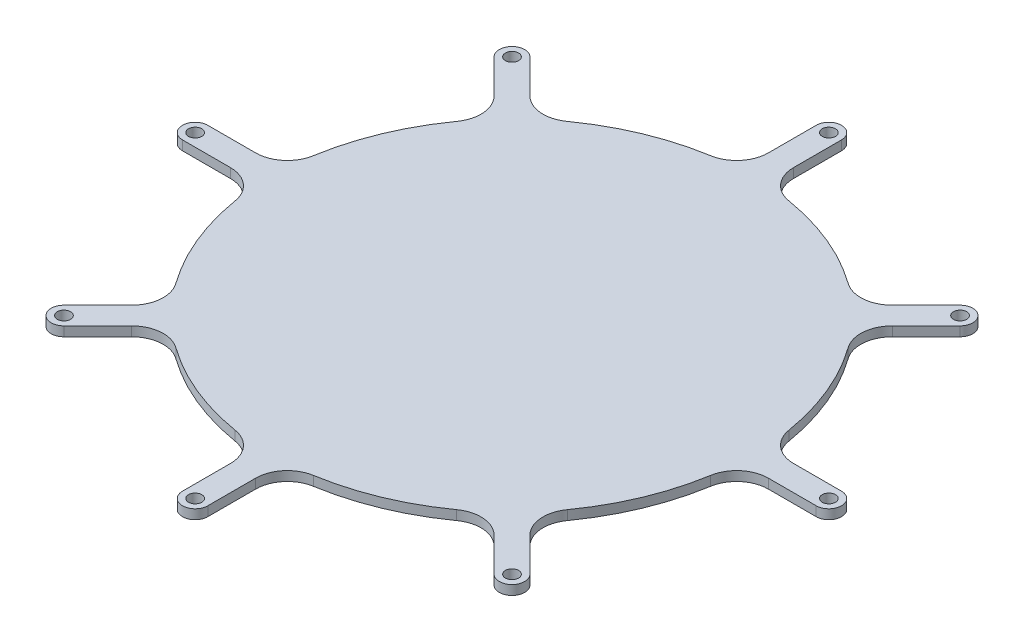
from build123d import *

# Parameters (mm, degrees)
BOSS_EXTRUDE1_DEPTH = 3
SKETCH3_R           = 2.1
CUT_EXTRUDE1_DEPTH  = 5
FILLET1_R           = 10


with BuildPart() as part:
    # Sketch1 → Boss-Extrude1 (new body)
    with BuildSketch(Plane(origin=(0, 0, 0), x_dir=(1, 0, 0), z_dir=(0, 1, 0))):
        with BuildLine():
            ThreePointArc((56.614433204, -50.957578955), (70.371903991, -29.148997043), (76.064899264, -4))
            Line((76.064899264, -4), (100.17, -4))
            ThreePointArc((100.17, -4), (104.17, 0), (100.17, 4))
            Line((100.17, 4), (76.064899264, 4))
            ThreePointArc((76.064899264, 4), (70.371903991, 29.148997043), (56.614433204, 50.957578955))
            Line((56.614433204, 50.957578955), (73.659313396, 68.002459147))
            ThreePointArc((73.659313396, 68.002459147), (73.659313396, 73.659313396), (68.002459147, 73.659313396))
            Line((68.002459147, 73.659313396), (50.957578955, 56.614433204))
            ThreePointArc((50.957578955, 56.614433204), (29.148997043, 70.371903991), (4, 76.064899264))
            Line((4, 76.064899264), (4, 100.17))
            ThreePointArc((4, 100.17), (0, 104.17), (-4, 100.17))
            Line((-4, 100.17), (-4, 76.064899264))
            ThreePointArc((-4, 76.064899264), (-29.148997043, 70.371903991), (-50.957578955, 56.614433204))
            Line((-50.957578955, 56.614433204), (-68.002459147, 73.659313396))
            ThreePointArc((-68.002459147, 73.659313396), (-73.659313396, 73.659313396), (-73.659313396, 68.002459147))
            Line((-73.659313396, 68.002459147), (-56.614433204, 50.957578955))
            ThreePointArc((-56.614433204, 50.957578955), (-70.371903991, 29.148997043), (-76.064899264, 4))
            Line((-76.064899264, 4), (-100.17, 4))
            ThreePointArc((-100.17, 4), (-104.17, 0), (-100.17, -4))
            Line((-100.17, -4), (-76.064899264, -4))
            ThreePointArc((-76.064899264, -4), (-70.371903991, -29.148997043), (-56.614433204, -50.957578955))
            Line((-56.614433204, -50.957578955), (-73.659313396, -68.002459147))
            ThreePointArc((-73.659313396, -68.002459147), (-73.659313396, -73.659313396), (-68.002459147, -73.659313396))
            Line((-68.002459147, -73.659313396), (-50.957578955, -56.614433204))
            ThreePointArc((-50.957578955, -56.614433204), (-29.148997043, -70.371903991), (-4, -76.064899264))
            Line((-4, -76.064899264), (-4, -100.17))
            ThreePointArc((-4, -100.17), (0, -104.17), (4, -100.17))
            Line((4, -100.17), (4, -76.064899264))
            ThreePointArc((4, -76.064899264), (29.148997043, -70.371903991), (50.957578955, -56.614433204))
            Line((50.957578955, -56.614433204), (68.002459147, -73.659313396))
            ThreePointArc((68.002459147, -73.659313396), (73.659313396, -73.659313396), (73.659313396, -68.002459147))
            Line((73.659313396, -68.002459147), (56.614433204, -50.957578955))
        make_face()
    extrude(amount=BOSS_EXTRUDE1_DEPTH)

    # Sketch3 → Cut-Extrude1 (cut)
    with BuildSketch(Plane(origin=(0, 3, 0), x_dir=(1, 0, 0), z_dir=(0, 1, 0))):
        with Locations((100.17, 0)):
            Circle(SKETCH3_R)
        with Locations((70.830886271, -70.830886271)):
            Circle(SKETCH3_R)
        with Locations((0, -100.17)):
            Circle(SKETCH3_R)
        with Locations((-70.830886271, -70.830886271)):
            Circle(SKETCH3_R)
        with Locations((-100.17, 0)):
            Circle(SKETCH3_R)
        with Locations((-70.830886271, 70.830886271)):
            Circle(SKETCH3_R)
        with Locations((0, 100.17)):
            Circle(SKETCH3_R)
        with Locations((70.830886271, 70.830886271)):
            Circle(SKETCH3_R)
    extrude(amount=-CUT_EXTRUDE1_DEPTH, mode=Mode.SUBTRACT)

    # Fillet1
    fillet1_edges = [part.edges().sort_by_distance(p)[0] for p in [
        (50.957578955, 1.5, 56.614433204),
        (-4, 1.5, 76.064899264),
        (-56.614433204, 1.5, 50.957578955),
        (-76.064899264, 1.5, 4),
        (-56.614433204, 1.5, -50.957578955),
        (-4, 1.5, -76.064899264),
        (-76.064899264, 1.5, -4),
        (-50.957578955, 1.5, -56.614433204),
        (50.957578955, 1.5, -56.614433204),
        (4, 1.5, -76.064899264),
        (76.064899264, 1.5, -4),
        (56.614433204, 1.5, -50.957578955),
        (76.064899264, 1.5, 4),
        (56.614433204, 1.5, 50.957578955),
        (4, 1.5, 76.064899264),
        (-50.957578955, 1.5, 56.614433204),
    ]]
    fillet(fillet1_edges, radius=FILLET1_R)


solid = part.part
